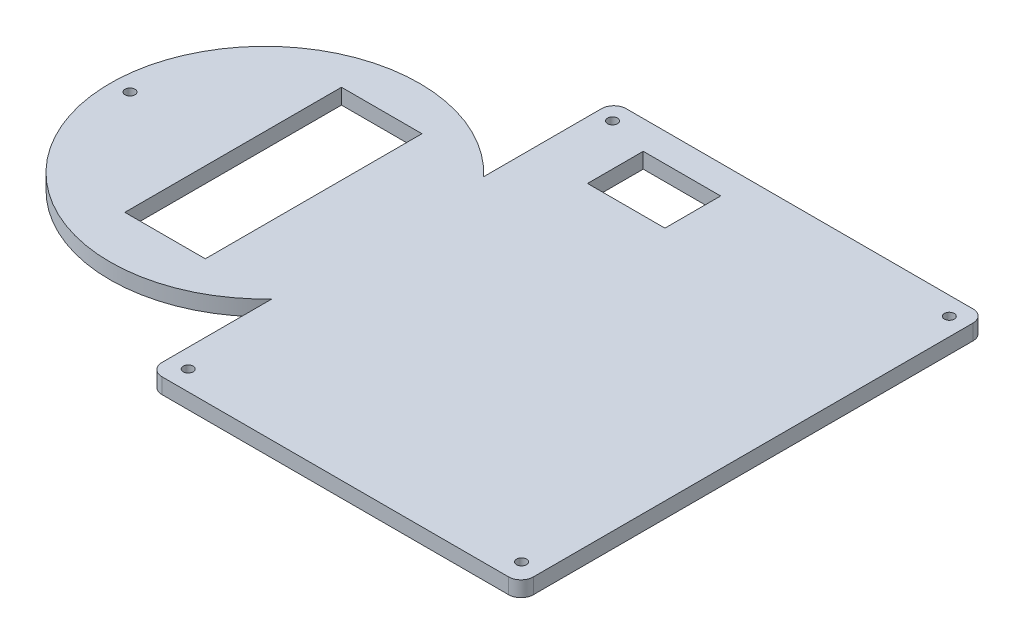
from build123d import *

# Parameters (mm, degrees)
SKETCH8_W                           = 120
SKETCH8_H                           = 150
BOSS_EXTRUDE3_DEPTH                 = 5
SKETCH9_R                           = 50
BOSS_EXTRUDE4_DEPTH                 = 5
BOSS_EXTRUDE8_DEPTH                 = 3
BOSS_EXTRUDE8_DEPTH_BACK            = 0.0001
SKETCH29_R                          = 3
CUT_EXTRUDE9_OUTLINE_R              = 3
CUT_EXTRUDE9_DEPTH                  = 0.01
F_7_32_0_21875_DIAMETER_HOLE1_D     = 3.2
F_7_32_0_21875_DIAMETER_HOLE1_DEPTH = 5
F_7_32_0_21875_DIAMETER_HOLE1_TIP   = 0.96137699
FILLET3_R                           = 4
SKETCH38_W                          = 26
SKETCH38_H                          = 70
CUT_EXTRUDE10_DEPTH                 = 40
SKETCH39_W                          = 25
SKETCH39_H                          = 18
CUT_EXTRUDE11_DEPTH                 = 40


# Read off the part's stored shape, not the designer's step: Cut-Extrude9
with BuildPart() as part:
    # Sketch8 → Boss-Extrude3 (new body)
    with BuildSketch(Plane(origin=(0, 0, 0), x_dir=(1, 0, 0), z_dir=(0, 1, 0))):
        with Locations((73.708855083, 72.164227744)):
            Rectangle(SKETCH8_W, SKETCH8_H)
    extrude(amount=BOSS_EXTRUDE3_DEPTH)

    # Sketch9 → Boss-Extrude4 (add)
    with BuildSketch(Plane(origin=(0, 0, 0), x_dir=(1, 0, 0), z_dir=(0, 1, 0))):
        with Locations((-22.779007595, 70.886233868)):
            Circle(SKETCH9_R)
    extrude(amount=BOSS_EXTRUDE4_DEPTH)

    # Sketch29 → Boss-Extrude8 (add, two sides: drawn at the far end of the back side and taken through both)
    with BuildSketch(Plane(origin=(0, 0, 0), x_dir=(1, 0, 0), z_dir=(0, 1, 0)).offset(-BOSS_EXTRUDE8_DEPTH_BACK)):
        with Locations(Location((19.708855083, 3.164227744, 0), (0, 0, 270))):
            Circle(SKETCH29_R)
    extrude(amount=BOSS_EXTRUDE8_DEPTH + BOSS_EXTRUDE8_DEPTH_BACK)

    # Cut-Extrude9 outline → Cut-Extrude9 (cut)
    with BuildSketch(Plane(origin=(0, 0, 0), x_dir=(1, 0, 0), z_dir=(0, 1, 0))):
        with Locations((127.708855083, 141.164227744)):
            Circle(CUT_EXTRUDE9_OUTLINE_R)
    extrude(amount=CUT_EXTRUDE9_DEPTH, mode=Mode.SUBTRACT)

    # 7/32 (0.21875) Diameter Hole1
    with Locations(Plane(origin=(0, 5, 0), x_dir=(1, 0, 0), z_dir=(0, 1, 0))):
        with Locations((18.917123201, 141.531370062), (127.969984407, 141.269223761), (127.602547564, 3.45328248), (19.774147178, 3.570575466), (-67.115618064, 71.668740496)):
            Hole(F_7_32_0_21875_DIAMETER_HOLE1_D / 2, depth=F_7_32_0_21875_DIAMETER_HOLE1_DEPTH)
            with Locations((0, 0, -(F_7_32_0_21875_DIAMETER_HOLE1_DEPTH + F_7_32_0_21875_DIAMETER_HOLE1_TIP / 2))):  # 118° drill point
                Cone(0, F_7_32_0_21875_DIAMETER_HOLE1_D / 2, F_7_32_0_21875_DIAMETER_HOLE1_TIP, mode=Mode.SUBTRACT)

    # Fillet3
    fillet3_edges = [part.edges().sort_by_distance(p)[0] for p in [
        (13.708855083, 2.5, -147.164227744),
        (133.708855083, 2.5, -147.164227744),
        (133.708855083, 2.5, 2.835772256),
        (13.708855083, 2.5, 2.835772256),
    ]]
    fillet(fillet3_edges, radius=FILLET3_R)

    # Sketch38 → Cut-Extrude10 (cut)
    with BuildSketch(Plane(origin=(0, 5, 0), x_dir=(1, 0, 0), z_dir=(0, 1, 0))):
        with Locations((-21.291144917, 72.164227744)):
            Rectangle(SKETCH38_W, SKETCH38_H)
    extrude(amount=-CUT_EXTRUDE10_DEPTH, mode=Mode.SUBTRACT)

    # Sketch39 → Cut-Extrude11 (cut)
    with BuildSketch(Plane(origin=(0, 5, 0), x_dir=(1, 0, 0), z_dir=(0, 1, 0))):
        with Locations((44.875898376, 128.991672485)):
            Rectangle(SKETCH39_W, SKETCH39_H)
    extrude(amount=-CUT_EXTRUDE11_DEPTH, mode=Mode.SUBTRACT)


solid = part.part
